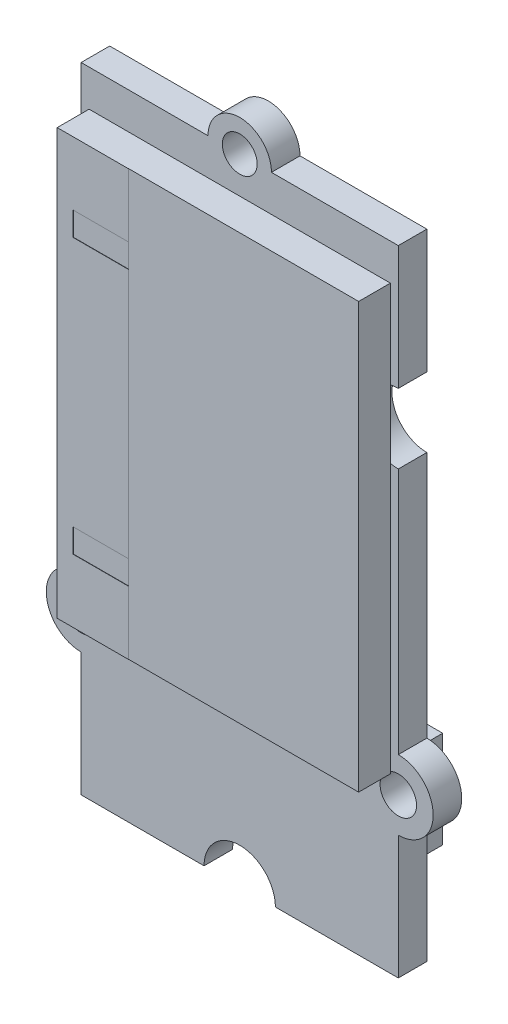
from build123d import *

# Parameters (mm, degrees)
ESQUISSE1_R             = 1.15
ESQUISSE1_R_2           = 1.1
BOSS_EXTRU_1_DEPTH      = 1.8
ESQUISSE2_W             = 19
ESQUISSE2_H             = 26.8
BOSS_EXTRU_2_DEPTH      = 2
ESQUISSE3_W             = 4.5
ESQUISSE3_H             = 26.8
BOSS_EXTRU_3_DEPTH      = 0.01
ESQUISSE4_W             = 3.5
ESQUISSE4_H             = 1.5
ENL_V_MAT_EXTRU_1_DEPTH = 0.02
ESQUISSE5_W             = 12
ESQUISSE5_H             = 8
BOSS_EXTRU_4_DEPTH      = 5
ESQUISSE6_W             = 3
ESQUISSE6_H             = 1.5
ENL_V_MAT_EXTRU_2_DEPTH = 1
ESQUISSE8_W             = 4.6
ESQUISSE8_H             = 3.292306134
ENL_V_MAT_EXTRU_3_DEPTH = 1
CHANFREIN1_SIZE         = 1
ENL_V_MAT_EXTRU_4_DEPTH = 5
ESQUISSE10_W            = 1
ESQUISSE10_H            = 1
ENL_V_MAT_EXTRU_5_DEPTH = 4
ESQUISSE11_W            = 1
ESQUISSE11_H            = 1
ENL_V_MAT_EXTRU_7_DEPTH = 5
ESQUISSE12_R            = 2.25
BOSS_EXTRU_5_DEPTH      = 3.3


with BuildPart() as part:
    # Esquisse1 → Boss.-Extru.1 (new body)
    with BuildSketch(Plane.XY):
        with BuildLine():
            Line((-12.744645331, 10.992907801), (-12.744645331, 3.192907801))
            ThreePointArc((-12.744645331, 3.192907801), (-14.944645331, 0.992907801), (-12.744645331, -1.207092199))
            Line((-12.744645331, -1.207092199), (-12.744645331, -9.007092199))
            Line((-12.744645331, -9.007092199), (-4.994645331, -9.007092199))
            ThreePointArc((-4.994645331, -9.007092199), (-2.744645331, -6.757092199), (-0.494645331, -9.007092199))
            Line((-0.494645331, -9.007092199), (7.255354669, -9.007092199))
            Line((7.255354669, -9.007092199), (7.255354669, -1.207092199))
            ThreePointArc((7.255354669, -1.207092199), (9.455354669, 0.992907801), (7.255354669, 3.192907801))
            Line((7.255354669, 3.192907801), (7.255354669, 10.992907801))
            Line((7.255354669, 10.992907801), (7.255354669, 18.792907801))
            ThreePointArc((7.255354669, 18.792907801), (5.055354669, 20.992907801), (7.255354669, 23.192907801))
            Line((7.255354669, 23.192907801), (7.255354669, 30.992907801))
            Line((7.255354669, 30.992907801), (-0.744645331, 30.992907801))
            ThreePointArc((-0.744645331, 30.992907801), (-2.744645331, 32.992907801), (-4.744645331, 30.992907801))
            Line((-4.744645331, 30.992907801), (-12.744645331, 30.992907801))
            Line((-12.744645331, 30.992907801), (-12.744645331, 23.192907801))
            ThreePointArc((-12.744645331, 23.192907801), (-10.544645331, 20.992907801), (-12.744645331, 18.792907801))
            Line((-12.744645331, 18.792907801), (-12.744645331, 10.992907801))
        make_face()
        with Locations((-12.744645331, 0.992907801)):
            Circle(ESQUISSE1_R, mode=Mode.SUBTRACT)
        with Locations((7.255354669, 0.992907801)):
            Circle(ESQUISSE1_R, mode=Mode.SUBTRACT)
        with Locations((-2.744645331, 30.992907801)):
            Circle(ESQUISSE1_R_2, mode=Mode.SUBTRACT)
    extrude(amount=BOSS_EXTRU_1_DEPTH)

    # Esquisse2 → Boss.-Extru.2 (add)
    with BuildSketch(Plane.XY.offset(1.8)):
        with Locations((-2.744645331, 15.292907801)):
            Rectangle(ESQUISSE2_W, ESQUISSE2_H)
    extrude(amount=BOSS_EXTRU_2_DEPTH)

    # Esquisse3 → Boss.-Extru.3 (add)
    with BuildSketch(Plane.XY.offset(3.8)):
        with Locations((-9.994645331, 15.292907801)):
            Rectangle(ESQUISSE3_W, ESQUISSE3_H)
    extrude(amount=BOSS_EXTRU_3_DEPTH)

    # Esquisse4 → Enlèv. mat.-Extru.1 (cut)
    with BuildSketch(Plane.XY.offset(3.81)):
        with Locations((-9.494645331, 23.942907801)):
            Rectangle(ESQUISSE4_W, ESQUISSE4_H)
        with Locations((-9.494645331, 6.642907801)):
            Rectangle(ESQUISSE4_W, ESQUISSE4_H)
    extrude(amount=-ENL_V_MAT_EXTRU_1_DEPTH, mode=Mode.SUBTRACT)

    # Esquisse5 → Boss.-Extru.4 (add)
    with BuildSketch(Plane(origin=(0, 0, 0), x_dir=(-1, 0, 0), z_dir=(0, 0, -1))):
        with Locations((2.744645331, -4.138713158)):
            Rectangle(ESQUISSE5_W, ESQUISSE5_H)
    extrude(amount=BOSS_EXTRU_4_DEPTH)

    # Esquisse6 → Enlèv. mat.-Extru.2 (cut)
    with BuildSketch(Plane(origin=(0, 0, -5), x_dir=(-1, 0, 0), z_dir=(0, 0, -1))):
        Polygon((8.744645331, -0.138713158), (-3.255354669, -0.138713158), (-3.255354669, -1.038713158), (-0.555354669, -1.038713158), (-0.555354669, -8.138713158), (6.044645331, -8.138713158), (6.044645331, -1.038713158), (8.744645331, -1.038713158), align=None)
        with Locations((2.725727115, -4.088713158)):
            Rectangle(ESQUISSE6_W, ESQUISSE6_H, mode=Mode.SUBTRACT)
    extrude(amount=-ENL_V_MAT_EXTRU_2_DEPTH, mode=Mode.SUBTRACT)

    # Esquisse8 → Enlèv. mat.-Extru.3 (cut)
    with BuildSketch(Plane(origin=(0, 0, -4), x_dir=(-1, 0, 0), z_dir=(0, 0, -1))):
        with Locations((2.744645331, -6.492560091)):
            Rectangle(ESQUISSE8_W, ESQUISSE8_H)
    extrude(amount=-ENL_V_MAT_EXTRU_3_DEPTH, mode=Mode.SUBTRACT)

    # Chanfrein1
    chanfrein1_edges = [part.edges().sort_by_distance(p)[0] for p in [
        (-2.725727115, -4.838713158, -5),
    ]]
    chamfer(chanfrein1_edges, length=CHANFREIN1_SIZE - 0.0001)  # a hair under: the kernel refuses the full size

    # Esquisse9 → Enlèv. mat.-Extru.4 (cut)
    with BuildSketch(Plane.XZ.offset(8.138713158)):
        Polygon((-7.144645331, -0.7), (1.655354669, -0.7), (1.655354669, -3.7), (1.655354669, -4.5), (0.855354669, -4.5), (0.855354669, -3.7), (-6.344645331, -3.7), (-6.344645331, -4.5), (-7.144645331, -4.5), (-7.144645331, -3.7), align=None)
    extrude(amount=-ENL_V_MAT_EXTRU_4_DEPTH, mode=Mode.SUBTRACT)

    # Esquisse10 → Enlèv. mat.-Extru.5 (cut)
    with BuildSketch(Plane.XZ.offset(8.138713158)):
        with Locations((-8.244645331, -3.5)):
            Rectangle(ESQUISSE10_W, ESQUISSE10_H)
        with Locations((2.755354669, -3.5)):
            Rectangle(ESQUISSE10_W, ESQUISSE10_H)
    extrude(amount=-ENL_V_MAT_EXTRU_5_DEPTH, mode=Mode.SUBTRACT)

    # Esquisse11 → Enlèv. mat.-Extru.7 (cut)
    with BuildSketch(Plane(origin=(0, 0, -5), x_dir=(-1, 0, 0), z_dir=(0, 0, -1))):
        with Locations((-2.755354669, -7.638713158)):
            Rectangle(ESQUISSE11_W, ESQUISSE11_H)
        with Locations((8.244645331, -7.638713158)):
            Rectangle(ESQUISSE11_W, ESQUISSE11_H)
    extrude(amount=-ENL_V_MAT_EXTRU_7_DEPTH, mode=Mode.SUBTRACT)

    # Esquisse12 → Boss.-Extru.5 (add)
    with BuildSketch(Plane(origin=(0, 0, 0), x_dir=(-1, 0, 0), z_dir=(0, 0, -1))):
        with Locations(Location((2.744645331, 20.036668052, 0), (0, 0, 180))):
            Circle(ESQUISSE12_R)
    extrude(amount=BOSS_EXTRU_5_DEPTH)


solid = part.part
